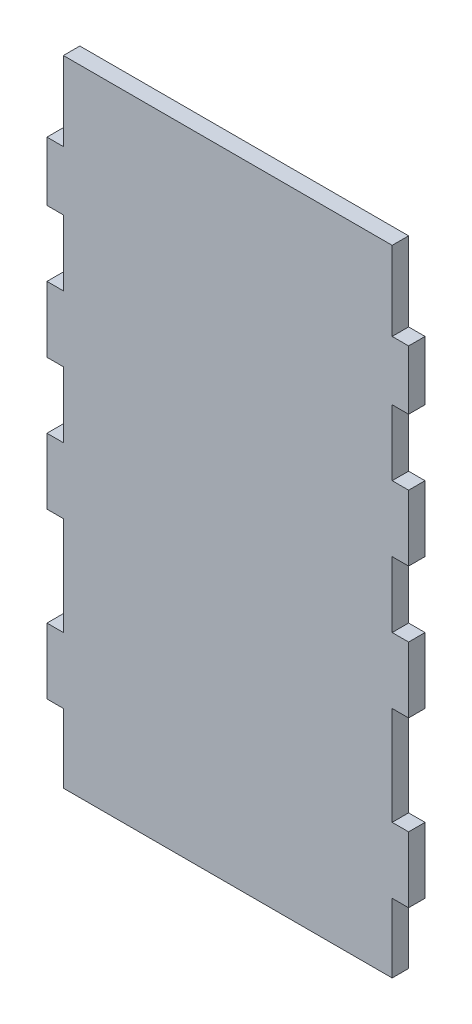
from build123d import *

# Parameters (mm, degrees)
SKETCH1_W           = 139.7
SKETCH1_H           = 246.38
BOSS_EXTRUDE1_DEPTH = 6.35
SKETCH2_W           = 6.35
SKETCH2_H           = 26.67
SKETCH2_H_2         = 38.1
SKETCH2_H_3         = 25.4
SKETCH2_H_4         = 31.75
CUT_EXTRUDE1_DEPTH  = 6.35
SKETCH7_W           = 6.35
SKETCH7_H           = 26.67
SKETCH7_H_2         = 31.75
SKETCH7_H_3         = 25.4
SKETCH7_H_4         = 38.1
CUT_EXTRUDE5_DEPTH  = 286.823368359
SKETCH6_W           = 6.35
SKETCH6_H           = 1.27
CUT_EXTRUDE6_DEPTH  = 286.823368359


with BuildPart() as part:
    # Sketch1 → Boss-Extrude1 (new body)
    with BuildSketch(Plane.XY):
        with Locations((-63.5, 129.54)):
            Rectangle(SKETCH1_W, SKETCH1_H)
    extrude(amount=BOSS_EXTRUDE1_DEPTH)

    # Sketch2 → Cut-Extrude1 (cut)
    with BuildSketch(Plane(origin=(6.35, 0, 0), x_dir=(0, 0, -1), z_dir=(1, 0, 0))):
        with Locations((-3.175, 19.685)):
            Rectangle(SKETCH2_W, SKETCH2_H)
        with Locations((-3.175, 77.47)):
            Rectangle(SKETCH2_W, SKETCH2_H_2)
        with Locations((-3.175, 134.62)):
            Rectangle(SKETCH2_W, SKETCH2_H_3)
        with Locations((-3.175, 185.42)):
            Rectangle(SKETCH2_W, SKETCH2_H_3)
        with Locations((-3.175, 236.855)):
            Rectangle(SKETCH2_W, SKETCH2_H_4)
    extrude(amount=-CUT_EXTRUDE1_DEPTH, mode=Mode.SUBTRACT)

    # Sketch7 → Cut-Extrude5 (cut, through all)
    with BuildSketch(Plane(origin=(0, 0, 0), x_dir=(-1, 0, 0), z_dir=(0, 0, -1))):
        with Locations((130.175, 19.685)):
            Rectangle(SKETCH7_W, SKETCH7_H)
        with Locations((130.175, 236.855)):
            Rectangle(SKETCH7_W, SKETCH7_H_2)
        with Locations((130.175, 185.42)):
            Rectangle(SKETCH7_W, SKETCH7_H_3)
        with Locations((130.175, 134.62)):
            Rectangle(SKETCH7_W, SKETCH7_H_3)
        with Locations((130.175, 77.47)):
            Rectangle(SKETCH7_W, SKETCH7_H_4)
    extrude(amount=-CUT_EXTRUDE5_DEPTH, mode=Mode.SUBTRACT)

    # Sketch6 → Cut-Extrude6 (cut, through all)
    with BuildSketch(Plane(origin=(0, 0, 0), x_dir=(0, 0, -1), z_dir=(1, 0, 0))):
        with Locations((-3.175, 252.095)):
            Rectangle(SKETCH6_W, SKETCH6_H)
    extrude(amount=-CUT_EXTRUDE6_DEPTH, mode=Mode.SUBTRACT)


solid = part.part
